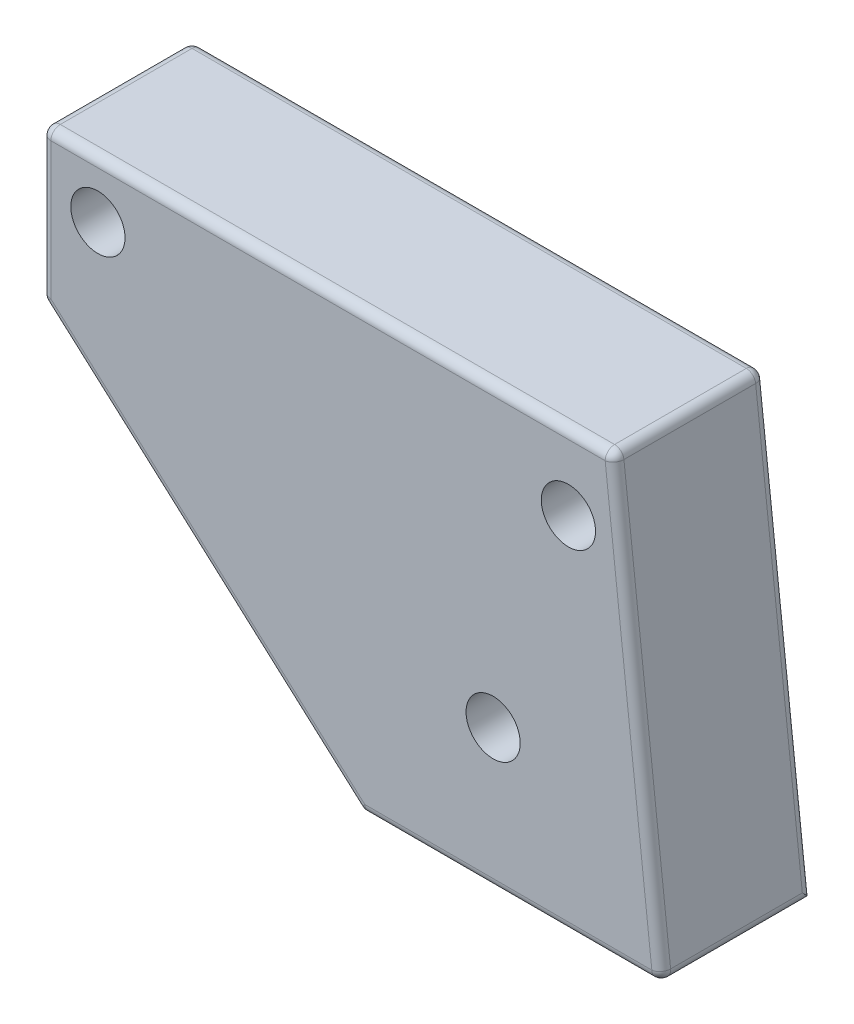
from build123d import *

# Parameters (mm, degrees)
SKETCH1_R           = 2.286
BOSS_EXTRUDE1_DEPTH = 12.7
SKETCH3_R           = 1.905
CUT_EXTRUDE1_DEPTH  = 25.4
FILLET1_R           = 0.79375


with BuildPart() as part:
    # Sketch1 → Boss-Extrude1 (new body)
    with BuildSketch(Plane.XY):
        Polygon((-25.4, 0), (0, 0), (-4.1148, 36.83), (-52.3748, 36.83), (-52.3748, 24.13), align=None)
        with Locations((-47.6123, 32.0675)):
            Circle(SKETCH1_R, mode=Mode.SUBTRACT)
        with Locations((-7.9248, 30.48)):
            Circle(SKETCH1_R, mode=Mode.SUBTRACT)
        with Locations((-14.2748, 11.826875)):
            Circle(SKETCH1_R, mode=Mode.SUBTRACT)
    extrude(amount=BOSS_EXTRUDE1_DEPTH)

    # Sketch3 → Cut-Extrude1 (cut)
    with BuildSketch(Plane.XZ):
        with Locations((-19.05, 6.35)):
            Circle(SKETCH3_R)
        with Locations((-6.35, 6.35)):
            Circle(SKETCH3_R)
    extrude(amount=-CUT_EXTRUDE1_DEPTH, mode=Mode.SUBTRACT)

    # Fillet1
    fillet1_edges = [part.edges().sort_by_distance(p)[0] for p in [
        (-52.3748, 30.48, 12.7),
        (-52.3748, 30.48, 0),
        (-52.3748, 24.13, 6.35),
        (-38.8874, 12.065, 12.7),
        (-25.4, 0, 6.35),
        (-38.8874, 12.065, 0),
        (0, 0, 6.35),
        (-2.0574, 18.415, 12.7),
        (-2.0574, 18.415, 0),
        (-4.1148, 36.83, 6.35),
        (-28.2448, 36.83, 12.7),
        (-52.3748, 36.83, 6.35),
        (-28.2448, 36.83, 0),
        (-12.7, 0, 12.7),
    ]]
    fillet(fillet1_edges, radius=FILLET1_R)


solid = part.part
